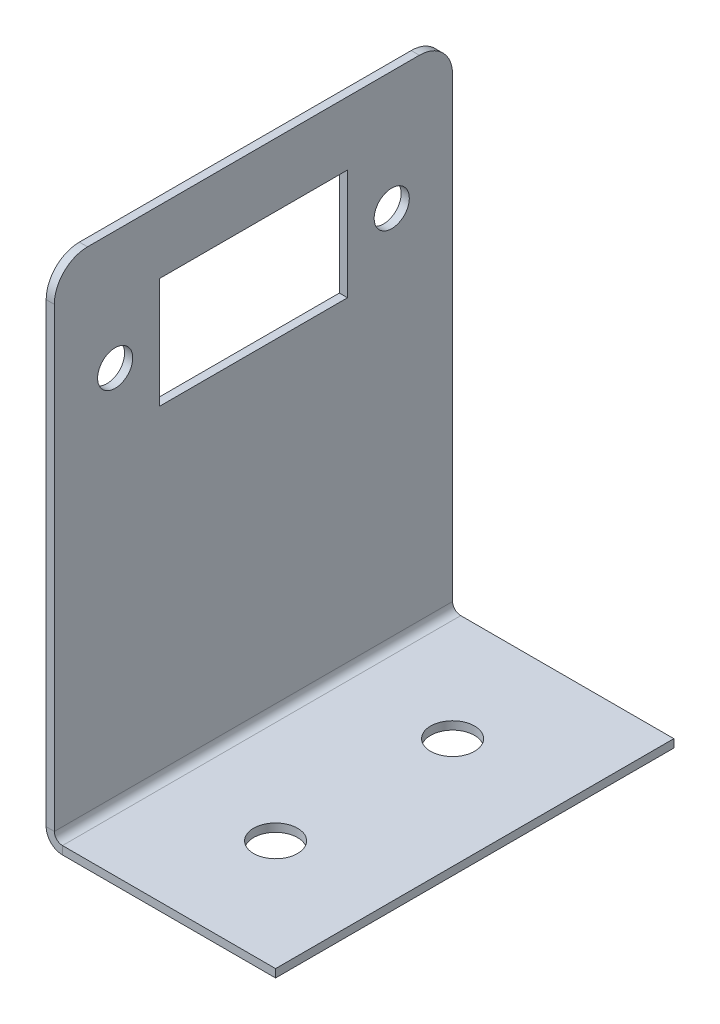
from build123d import *

# Parameters (mm, degrees)
BASE_FLANGE1_DEPTH = 18
SKETCH6_R          = 1.5875
SKETCH6_W          = 17
SKETCH6_H          = 10
CUT_EXTRUDE1_DEPTH = 53.430906916
SKETCH7_R          = 1.984375
CUT_EXTRUDE2_DEPTH = 53.430906916
FILLET1_R          = 3


# Sheet-metal steps are written as plain solids
with BuildPart() as part:
    # Sketch1 → Base-Flange1 (new, symmetric)
    with BuildSketch(Plane.XY):
        with BuildLine():
            Line((0, 45), (0, 0.7366))
            ThreePointArc((0, 0.7366), (0.215745145, 0.215745145), (0.7366, 0))
            Line((0.7366, 0), (20, 0))
            Line((20, 0), (20, -0.7366))
            Line((20, -0.7366), (0.7366, -0.7366))
            ThreePointArc((0.7366, -0.7366), (-0.30510971, -0.30510971), (-0.7366, 0.7366))
            Line((-0.7366, 0.7366), (-0.7366, 45))
            Line((-0.7366, 45), (0, 45))
        make_face()
    extrude(amount=BASE_FLANGE1_DEPTH, both=True)

    # Sketch6 → Cut-Extrude1 (cut, through all)
    with BuildSketch(Plane(origin=(0, 0, 0), x_dir=(0, 0, -1), z_dir=(1, 0, 0))):
        with Locations(Location((-12.5, 34.2634, 0), (0, 0, 90))):
            Circle(SKETCH6_R)
        with Locations(Location((12.5, 34.2634, 0), (0, 0, 90))):
            Circle(SKETCH6_R)
        with Locations((0, 34.2634)):
            Rectangle(SKETCH6_W, SKETCH6_H)
    extrude(amount=-CUT_EXTRUDE1_DEPTH, mode=Mode.SUBTRACT)

    # Sketch7 → Cut-Extrude2 (cut, through all)
    with BuildSketch(Plane(origin=(0, 0, 0), x_dir=(1, 0, 0), z_dir=(0, 1, 0))):
        with Locations(Location((10, 8, 0), (0, 0, 270))):
            Circle(SKETCH7_R)
        with Locations(Location((10, -8, 0), (0, 0, 270))):
            Circle(SKETCH7_R)
    extrude(amount=-CUT_EXTRUDE2_DEPTH, mode=Mode.SUBTRACT)

    # Fillet1
    fillet1_edges = [part.edges().sort_by_distance(p)[0] for p in [
        (-0.3683, 45, 18),
        (-0.3683, 45, -18),
    ]]
    fillet(fillet1_edges, radius=FILLET1_R)


solid = part.part
